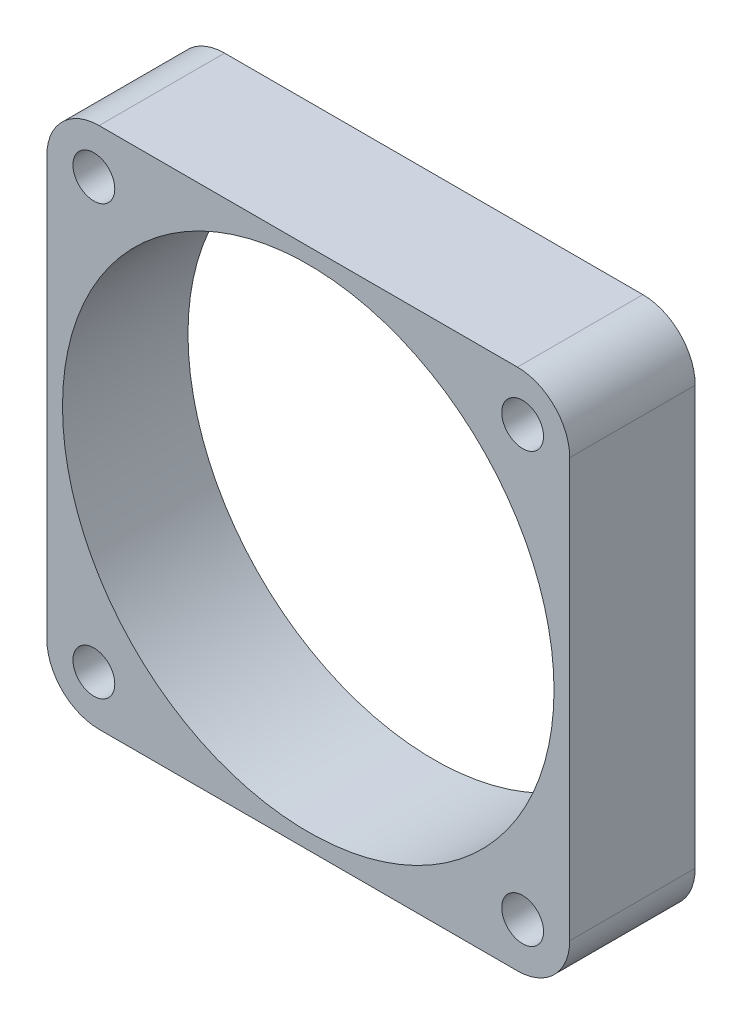
from build123d import *

# Parameters (mm, degrees)
SKETCH_1_W      = 50
SKETCH_1_H      = 50
SKETCH_1_R      = 2
SKETCH_1_R_2    = 23.5
EXTRUDE_1_DEPTH = 12
FILLET_1_R      = 5


with BuildPart() as part:
    # 草图1 → 凸台-拉伸1 (new body)
    with BuildSketch(Plane.XY):
        with Locations((-26.20618851, -18.866504484)):
            Rectangle(SKETCH_1_W, SKETCH_1_H)
        with Locations((-46.70618851, -39.366504484)):
            Circle(SKETCH_1_R, mode=Mode.SUBTRACT)
        with Locations((-5.70618851, -39.366504484)):
            Circle(SKETCH_1_R, mode=Mode.SUBTRACT)
        with Locations((-5.70618851, 1.633495516)):
            Circle(SKETCH_1_R, mode=Mode.SUBTRACT)
        with Locations((-46.70618851, 1.633495516)):
            Circle(SKETCH_1_R, mode=Mode.SUBTRACT)
        with Locations((-26.20618851, -18.866504484)):
            Circle(SKETCH_1_R_2, mode=Mode.SUBTRACT)
    extrude(amount=EXTRUDE_1_DEPTH)

    # 圆角1
    fillet_1_edges = [part.edges().sort_by_distance(p)[0] for p in [
        (-51.20618851, -43.866504484, 6),
        (-51.20618851, 6.133495516, 6),
        (-1.20618851, -43.866504484, 6),
        (-1.20618851, 6.133495516, 6),
    ]]
    fillet(fillet_1_edges, radius=FILLET_1_R)


solid = part.part
